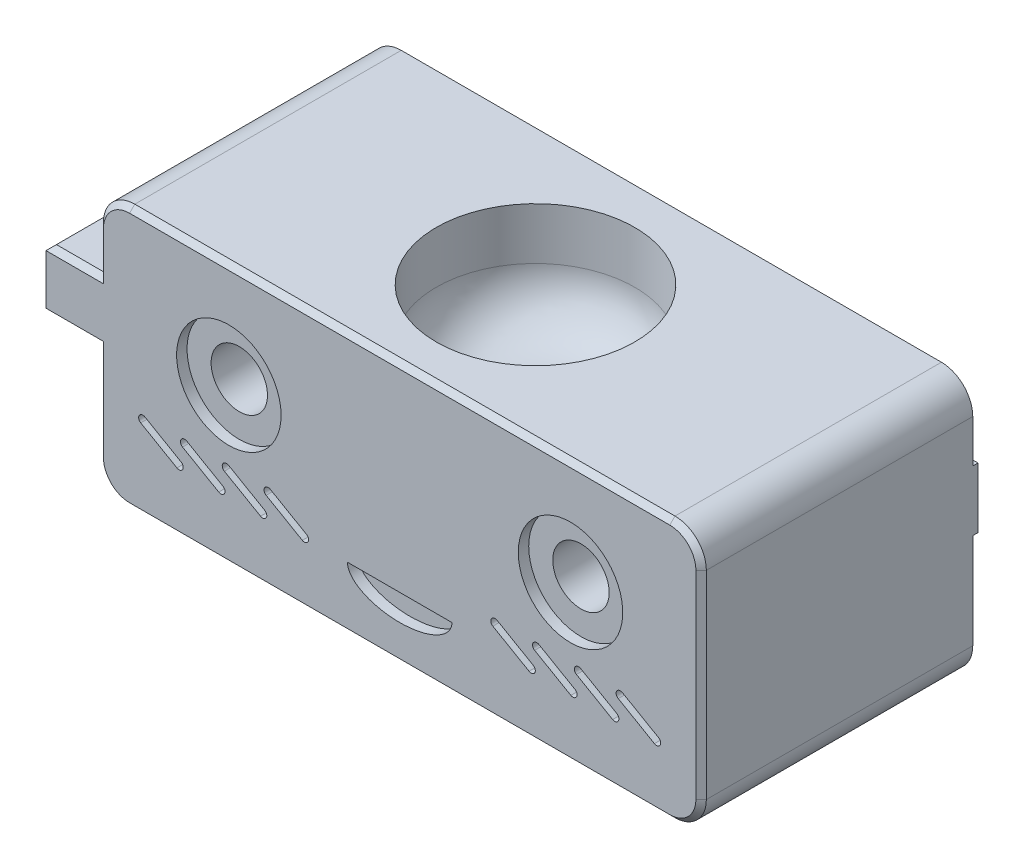
from build123d import *

# Parameters (mm, degrees)
SKETCH_3_R          = 2.7
EXTRUDE_2_DEPTH     = 26
SKETCH_5_R          = 5
CUT_EXTRUDE_1_DEPTH = 1
CUT_EXTRUDE_2_DEPTH = 1
CUT_EXTRUDE_3_DEPTH = 24
EXTRUDE_3_DEPTH     = 1
CHAMFER_1_SIZE      = 0.5
SKETCH_9_W          = 21
SKETCH_9_H          = 5.775015532
EXTRUDE_4_DEPTH     = 5
CHAMFER_3_SIZE      = 0.5
EXTRUDE_5_DEPTH     = 10
CHAMFER_4_SIZE      = 2


with BuildPart() as part:
    # 草图3 → 凸台-拉伸2 (new body)
    with BuildSketch(Plane.XY):
        with BuildLine():
            Line((25.85, 10), (-25.85, 10))
            ThreePointArc((-25.85, 10), (-27.971320344, 9.121320344), (-28.85, 7))
            Line((-28.85, 7), (-28.85, 0))
            Line((-28.85, 0), (-28.85, -12))
            ThreePointArc((-28.85, -12), (-27.971320344, -14.121320344), (-25.85, -15))
            Line((-25.85, -15), (25.85, -15))
            ThreePointArc((25.85, -15), (27.971320344, -14.121320344), (28.85, -12))
            Line((28.85, -12), (28.85, 0))
            Line((28.85, 0), (28.85, 7))
            ThreePointArc((28.85, 7), (27.971320344, 9.121320344), (25.85, 10))
        make_face()
        with Locations((-16.35, 0)):
            Circle(SKETCH_3_R, mode=Mode.SUBTRACT)
        with Locations((16.35, 0)):
            Circle(SKETCH_3_R, mode=Mode.SUBTRACT)
    extrude(amount=EXTRUDE_2_DEPTH)

    # 草图5 → 切除-拉伸1 (cut)
    with BuildSketch(Plane.XY.offset(26)):
        with Locations((-16.35, 0)):
            Circle(SKETCH_5_R)
        with Locations((16.35, 0)):
            Circle(SKETCH_5_R)
    extrude(amount=-CUT_EXTRUDE_1_DEPTH, mode=Mode.SUBTRACT)

    # 草图6 → 切除-拉伸2 (cut)
    with BuildSketch(Plane.XY.offset(26)):
        with BuildLine():
            Line((5, -9.000269215), (-5, -9.000269215))
            add(Edge.make_bspline(
                [(-5, -9.000269215), (-5, -11.500269215), (0, -11.500269215), (5, -11.500269215), (5, -9.000269215)],
                knots=[3.141592654, 3.141592654, 3.141592654, 4.71238898, 4.71238898, 6.283185307, 6.283185307, 6.283185307], degree=2, weights=[1, 0.707106781, 1, 0.707106781, 1]))
        make_face()
        with BuildLine():
            Line((-21.317949192, -9.346410161), (-24.782050808, -7.346410161))
            ThreePointArc((-24.782050808, -7.346410161), (-24.928460969, -6.8), (-24.382050808, -6.653589838))
            Line((-24.382050808, -6.653589838), (-20.917949192, -8.653589838))
            ThreePointArc((-20.917949192, -8.653589838), (-20.771539031, -9.2), (-21.317949192, -9.346410161))
        make_face()
        with BuildLine():
            Line((-17.317949192, -9.346410161), (-20.782050808, -7.346410161))
            ThreePointArc((-20.782050808, -7.346410161), (-20.928460969, -6.8), (-20.382050808, -6.653589838))
            Line((-20.382050808, -6.653589838), (-16.917949192, -8.653589838))
            ThreePointArc((-16.917949192, -8.653589838), (-16.771539031, -9.2), (-17.317949192, -9.346410161))
        make_face()
        with BuildLine():
            Line((-13.317949192, -9.346410161), (-16.782050808, -7.346410161))
            ThreePointArc((-16.782050808, -7.346410161), (-16.928460969, -6.8), (-16.382050808, -6.653589838))
            Line((-16.382050808, -6.653589838), (-12.917949192, -8.653589838))
            ThreePointArc((-12.917949192, -8.653589838), (-12.771539031, -9.2), (-13.317949192, -9.346410161))
        make_face()
        with BuildLine():
            Line((-9.317949192, -9.346410161), (-12.782050808, -7.346410161))
            ThreePointArc((-12.782050808, -7.346410161), (-12.928460969, -6.8), (-12.382050808, -6.653589838))
            Line((-12.382050808, -6.653589838), (-8.917949192, -8.653589838))
            ThreePointArc((-8.917949192, -8.653589838), (-8.771539031, -9.2), (-9.317949192, -9.346410161))
        make_face()
        with BuildLine():
            Line((12.382050808, -9.346410161), (8.917949192, -7.346410161))
            ThreePointArc((8.917949192, -7.346410161), (8.771539031, -6.8), (9.317949192, -6.653589838))
            Line((9.317949192, -6.653589838), (12.782050808, -8.653589838))
            ThreePointArc((12.782050808, -8.653589838), (12.928460969, -9.2), (12.382050808, -9.346410161))
        make_face()
        with BuildLine():
            Line((16.382050808, -9.346410161), (12.917949192, -7.346410161))
            ThreePointArc((12.917949192, -7.346410161), (12.771539031, -6.8), (13.317949192, -6.653589838))
            Line((13.317949192, -6.653589838), (16.782050808, -8.653589838))
            ThreePointArc((16.782050808, -8.653589838), (16.928460969, -9.2), (16.382050808, -9.346410161))
        make_face()
        with BuildLine():
            Line((20.382050808, -9.346410161), (16.917949192, -7.346410161))
            ThreePointArc((16.917949192, -7.346410161), (16.771539031, -6.8), (17.317949192, -6.653589838))
            Line((17.317949192, -6.653589838), (20.782050808, -8.653589838))
            ThreePointArc((20.782050808, -8.653589838), (20.928460969, -9.2), (20.382050808, -9.346410161))
        make_face()
        with BuildLine():
            Line((24.382050808, -9.346410161), (20.917949192, -7.346410161))
            ThreePointArc((20.917949192, -7.346410161), (20.771539031, -6.8), (21.317949192, -6.653589838))
            Line((21.317949192, -6.653589838), (24.782050808, -8.653589838))
            ThreePointArc((24.782050808, -8.653589838), (24.928460969, -9.2), (24.382050808, -9.346410161))
        make_face()
    extrude(amount=-CUT_EXTRUDE_2_DEPTH, mode=Mode.SUBTRACT)

    # 草图7 → 切除-拉伸3 (cut, symmetric)
    with BuildSketch(Plane(origin=(0, 0, 0), x_dir=(0, 0, -1), z_dir=(1, 0, 0))):
        Polygon((0, 8.4), (-1.8, 8.4), (-7.2, 3), (-7.2, -6.8), (-18.2, -6.8), (-18.2, -15), (0, -15), align=None)
    extrude(amount=CUT_EXTRUDE_3_DEPTH, both=True, mode=Mode.SUBTRACT)

    # 草图8 → 凸台-拉伸3 (add)
    with BuildSketch(Plane.XY):
        Polygon((-24, 2.9), (-28.85, 2.9), (-28.85, -2.875015532), (-24, -2.9), align=None)
        Polygon((28.85, -2.875015532), (24, -2.9), (24, 2.9), (28.85, 2.9), align=None)
    extrude(amount=-EXTRUDE_3_DEPTH)

    # 倒角1
    chamfer_1_edges = [part.edges().sort_by_distance(p)[0] for p in [
        (-26.425, 2.9, -1),
        (-28.85, 0.012492234, -1),
        (-26.425, -2.887507766, -1),
        (-24, 0, -1),
        (26.425, 2.9, -1),
        (24, 0, -1),
        (26.425, -2.887507766, -1),
        (28.85, 0.012492234, -1),
    ]]
    chamfer(chamfer_1_edges, length=CHAMFER_1_SIZE)

    # 草图9 → 凸台-拉伸4 (add)
    with BuildSketch(Plane.ZY.offset(28.85)):
        with Locations((15.5, 0.012492234)):
            Rectangle(SKETCH_9_W, SKETCH_9_H)
    extrude(amount=EXTRUDE_4_DEPTH)

    # 倒角3
    chamfer_3_edges = [part.edges().sort_by_distance(p)[0] for p in [
        (-31.35, -2.875015532, 26),
        (-33.85, -2.875015532, 15.5),
        (-33.85, 0.012492234, 5),
        (-33.85, 2.9, 15.5),
        (-31.35, 2.9, 26),
        (-28.85, -7.437507766, 26),
        (-27.971320344, -14.121320344, 26),
        (0, -15, 26),
        (27.971320344, -14.121320344, 26),
        (28.85, -2.5, 26),
        (-28.85, 4.95, 26),
        (27.971320344, 9.121320344, 26),
        (-27.971320344, 9.121320344, 26),
        (0, 10, 26),
    ]]
    chamfer(chamfer_3_edges, length=CHAMFER_3_SIZE)

    # 草图10 → 凸台-拉伸5 (add, symmetric)
    with BuildSketch(Plane(origin=(0, 0, 0), x_dir=(0, 0, -1), z_dir=(1, 0, 0))):
        Polygon((-7.2, -6.8), (0, -6.8), (0, 8.4), (-1.8, 8.4), (-7.2, 3), align=None)
    extrude(amount=EXTRUDE_5_DEPTH, both=True)

    # 倒角4
    chamfer_4_edges = [part.edges().sort_by_distance(p)[0] for p in [
        (-10, -1.9, 7.2),
        (-10, 5.7, 4.5),
        (-10, 8.4, 0.9),
        (10, -1.9, 7.2),
        (10, 8.4, 0.9),
        (10, 5.7, 4.5),
    ]]
    chamfer(chamfer_4_edges, length=CHAMFER_4_SIZE)

    # 草图4 → 切除-旋转1 (revolve, cut)
    with BuildSketch(Plane(origin=(0, 0, 0), x_dir=(0, 0, -1), z_dir=(1, 0, 0))):
        with BuildLine():
            Line((-13, 10), (-13, -15))
            Line((-13, -15), (-11.4, -15))
            Line((-11.4, -15), (-11.4, 0))
            Line((-11.4, 0), (-8.8, 0))
            ThreePointArc((-8.8, 0), (-5.068620963, 1.38559814), (-3.5, 5.043808085))
            Line((-3.5, 5.043808085), (-3.5, 10))
            Line((-3.5, 10), (-13, 10))
        make_face()
    revolve(axis=Axis((0, 10, 13), (0, -1, 0)), mode=Mode.SUBTRACT)


solid = part.part
